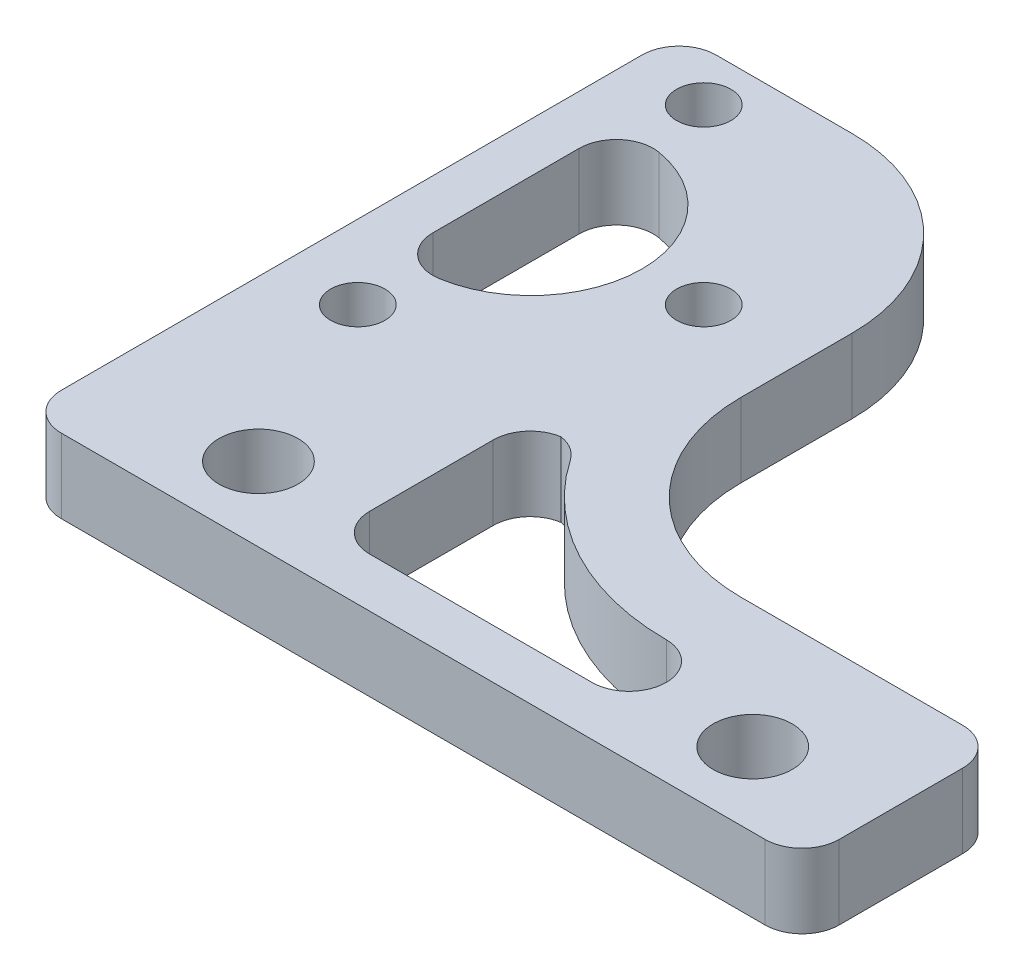
from build123d import *

# Parameters (mm, degrees)
SKETCH_1_W          = 31.48
SKETCH_1_H          = 26.5
SKETCH_1_R          = 1.1
SKETCH_1_R_2        = 1.6
EXTRUDE_1_DEPTH     = 3
SKETCH_2_W          = 17.48
SKETCH_2_H          = 18.5
CUT_EXTRUDE_1_DEPTH = 21.5
FILLET_1_R          = 7
CUT_EXTRUDE_2_DEPTH = 21.5
FILLET_2_R          = 1.5


with BuildPart() as part:
    # 草图1 → 凸台-拉伸1 (new body)
    with BuildSketch(Plane(origin=(0, 0, 0), x_dir=(1, 0, 0), z_dir=(0, 1, 0))):
        with Locations((12.74, -4.25)):
            Rectangle(SKETCH_1_W, SKETCH_1_H)
        with Locations(Location((0, 7, 0), (0, 0, 270))):
            Circle(SKETCH_1_R, mode=Mode.SUBTRACT)
        with Locations(Location((7, 0, 0), (0, 0, 270))):
            Circle(SKETCH_1_R, mode=Mode.SUBTRACT)
        with Locations(Location((0, -7, 0), (0, 0, 270))):
            Circle(SKETCH_1_R, mode=Mode.SUBTRACT)
        with Locations(Location((3.48, -14.5, 0), (0, 0, 270))):
            Circle(SKETCH_1_R_2, mode=Mode.SUBTRACT)
        with Locations(Location((23.48, -14.5, 0), (0, 0, 270))):
            Circle(SKETCH_1_R_2, mode=Mode.SUBTRACT)
    extrude(amount=EXTRUDE_1_DEPTH)

    # 草图2 → 切除-拉伸1 (cut)
    with BuildSketch(Plane(origin=(0, 3, 0), x_dir=(1, 0, 0), z_dir=(0, 1, 0))):
        with Locations((19.74, -0.25)):
            Rectangle(SKETCH_2_W, SKETCH_2_H)
        with BuildLine():
            Line((-1, 4.387482194), (-1, -4.387482194))
            ThreePointArc((-1, -4.387482194), (4.5, 0), (-1, 4.387482194))
        make_face()
    extrude(amount=-CUT_EXTRUDE_1_DEPTH, mode=Mode.SUBTRACT)

    # 圆角1
    fillet_1_edges = [part.edges().sort_by_distance(p)[0] for p in [
        (11, 1.5, -9),
        (11, 1.5, 9.5),
    ]]
    fillet(fillet_1_edges, radius=FILLET_1_R)

    # 草图3 → 切除-拉伸2 (cut)
    with BuildSketch(Plane(origin=(0, 3, 0), x_dir=(1, 0, 0), z_dir=(0, 1, 0))):
        with BuildLine():
            Line((7.48, -7.5), (7.48, -15.5))
            Line((7.48, -15.5), (19.48, -15.5))
            Line((19.48, -15.5), (19.48, -12.389873609))
            ThreePointArc((19.48, -12.389873609), (13.656415306, -11.507400958), (9.339745962, -7.5))
            Line((9.339745962, -7.5), (7.48, -7.5))
        make_face()
    extrude(amount=-CUT_EXTRUDE_2_DEPTH, mode=Mode.SUBTRACT)

    # 圆角2
    # the kernel refuses this fillet: 1.5 mm, written as the material it adds along each edge
    with BuildSketch(Plane(origin=(-1, 3, -4.387482194), x_dir=(0, 0, 1), z_dir=(0, -1, 0))) as fillet_2_piece_1:
        with BuildLine():
            CenterArc((1.429442302, -1.5), FILLET_2_R, 90, 99.594068227)
            ThreePointArc((-0.049577644, -1.75), (-0.110713057, -0.872565759), (0, 0))
            Line((0, 0), (1.429442302, 0))
        make_face()
    extrude(amount=3)
    with BuildSketch(Plane(origin=(-1, 3, 4.387482194), x_dir=(0, 0, -1), z_dir=(0, -1, 0))) as fillet_2_piece_2:
        with BuildLine():
            CenterArc((1.429442302, 1.5), FILLET_2_R, 170.405931773, 99.594068227)
            ThreePointArc((-0.049577644, 1.75), (-0.110713057, 0.872565759), (0, 0))
            Line((0, 0), (1.429442302, 0))
        make_face()
    extrude(amount=3)
    with BuildSketch(Plane(origin=(19.48, 3, 12.389873609), x_dir=(-0.9973071885231932, 0, 0.07333738282733993), z_dir=(0, -1, 0))) as fillet_2_piece_3:
        with BuildLine():
            CenterArc((1.614041963, -1.495767206), FILLET_2_R, 94.30534313, 89.900355116)
            Line((0.11808118, -1.60577328), (0, 0))
            ThreePointArc((0, 0), (0.750717192, -0.02821863), (1.501434384, 0))
        make_face()
    extrude(amount=3)
    with BuildSketch(Plane(origin=(19.48, 3, 15.5), x_dir=(0, 0, -1), z_dir=(0, -1, 0)), Plane(origin=(7.48, 3, 7.5), x_dir=(0, 0, 1), z_dir=(0, -1, 0))) as fillet_2_piece_4:
        with BuildLine():
            CenterArc((FILLET_2_R, -FILLET_2_R), FILLET_2_R, 90, 90)
            Line((0, -FILLET_2_R), (0, 0))
            Line((0, 0), (FILLET_2_R, 0))
        make_face()
    extrude(amount=3)
    with BuildSketch(Plane(origin=(7.48, 3, 15.5), x_dir=(0, 0, -1), z_dir=(0, -1, 0))) as fillet_2_piece_5:
        with BuildLine():
            CenterArc((FILLET_2_R, FILLET_2_R), FILLET_2_R, 180, 90)
            Line((0, FILLET_2_R), (0, 0))
            Line((0, 0), (FILLET_2_R, 0))
        make_face()
    extrude(amount=3)
    with BuildSketch(Plane(origin=(9.339745962, 3, 7.5), x_dir=(-1, 0, 0), z_dir=(0, -1, 0))) as fillet_2_piece_6:
        with BuildLine():
            CenterArc((0.826578943, -1.5), FILLET_2_R, 90, 55.58261129)
            ThreePointArc((-0.410834055, -0.652173913), (-0.199131088, -0.330046756), (0, 0))
            Line((0, 0), (0.826578943, 0))
        make_face()
    extrude(amount=3)
    # the kernel refuses this fillet: 1.5 mm, written as the material it takes off along each edge
    with BuildSketch(Plane(origin=(28.48, 6.75, 9.5), x_dir=(-1, 0, 0), z_dir=(0, -1, 0)), Plane(origin=(-3, -3.75, 17.5), x_dir=(0, 0, -1), z_dir=(0, 1, 0)), Plane(origin=(-3, -3.75, -9), x_dir=(1, 0, 0), z_dir=(0, 1, 0))) as fillet_2_2_piece_1:
        with BuildLine():
            CenterArc((FILLET_2_R, -FILLET_2_R), FILLET_2_R, 90, 90)
            Line((0, -FILLET_2_R), (0, 0))
            Line((0, 0), (FILLET_2_R, 0))
        make_face()
    extrude(amount=10.5, mode=Mode.SUBTRACT)
    with BuildSketch(Plane(origin=(28.48, -3.75, 17.5), x_dir=(0, 0, -1), z_dir=(0, 1, 0))) as fillet_2_2_piece_2:
        with BuildLine():
            CenterArc((FILLET_2_R, FILLET_2_R), FILLET_2_R, 180, 90)
            Line((0, FILLET_2_R), (0, 0))
            Line((0, 0), (FILLET_2_R, 0))
        make_face()
    extrude(amount=10.5, mode=Mode.SUBTRACT)


solid = part.part
